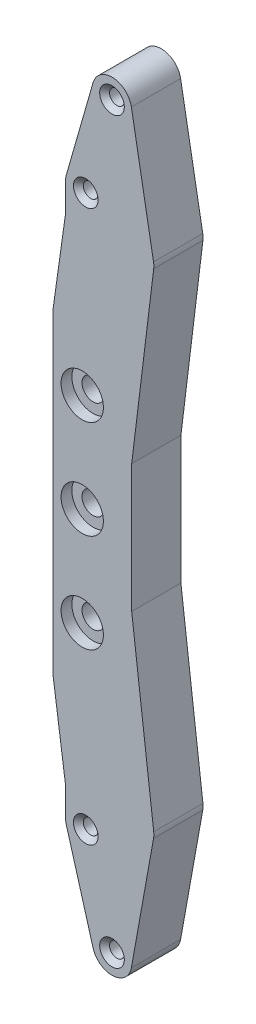
from build123d import *

# Parameters (mm, degrees)
BOSS_EXTRUDE1_DEPTH             = 10
CBORE_FOR_M4_SBHCS1_D           = 4.5
CBORE_FOR_M4_SBHCS1_CBORE_D     = 8.6
CBORE_FOR_M4_SBHCS1_CBORE_DEPTH = 2.2
CSK_FOR_M3_SFHCS1_D             = 3
CSK_FOR_M3_SFHCS1_CSINK_D       = 5
CSK_FOR_M3_SFHCS1_CSINK_ANGLE   = 90


with BuildPart() as part:
    # Sketch1 → Boss-Extrude1 (new body)
    with BuildSketch(Plane.XY):
        with BuildLine():
            Line((20.436693838, 18.708620927), (19.344510591, 24.776314356))
            Line((19.344510591, 24.776314356), (15.93670037, 43.708620578))
            ThreePointArc((15.93670037, 43.708620578), (12.202200675, 46.994894023), (8.154920075, 44.102559177))
            Line((8.154920075, 44.102559177), (2.711450691, 25.118928734))
            ThreePointArc((2.711450691, 25.118928734), (2.59310332, 24.564962257), (2.551837824, 24.000000209))
            Line((2.551837824, 24.000000209), (2.527056728, 18.001748249))
            Line((2.527056728, 18.001748249), (0, 0))
            Line((0, 0), (0, -64.000001177))
            Line((0, -64.000001177), (2.527056728, -82.001749426))
            Line((2.527056728, -82.001749426), (2.551837824, -88.000001386))
            ThreePointArc((2.551837824, -88.000001386), (2.59310332, -88.564963435), (2.711450691, -89.118929911))
            Line((2.711450691, -89.118929911), (8.154920075, -108.102560354))
            ThreePointArc((8.154920075, -108.102560354), (12.202200675, -110.9948952), (15.93670037, -107.708621755))
            Line((15.93670037, -107.708621755), (19.344510591, -88.776315534))
            Line((19.344510591, -88.776315534), (20.436693838, -82.708622104))
            ThreePointArc((20.436693838, -82.708622104), (20.49837734, -82.112535779), (20.470315461, -81.513923807))
            Line((20.470315461, -81.513923807), (15.999950788, -45.00001147))
            Line((15.999950788, -45.00001147), (15.999950788, -18.999989708))
            Line((15.999950788, -18.999989708), (20.470315461, 17.51392263))
            ThreePointArc((20.470315461, 17.51392263), (20.49837734, 18.112534602), (20.436693838, 18.708620927))
        make_face()
    extrude(amount=-BOSS_EXTRUDE1_DEPTH)

    # CBORE for M4 SBHCS1 (through all)
    with Locations(Plane.XY):
        with Locations((5.95, -32.000000589), (5.95, -12.000000589), (5.95, -52.000000589)):
            CounterBoreHole(CBORE_FOR_M4_SBHCS1_D / 2, CBORE_FOR_M4_SBHCS1_CBORE_D / 2, CBORE_FOR_M4_SBHCS1_CBORE_DEPTH)

    # CSK for M3 SFHCS1 (through all)
    with Locations(Plane.XY):
        with Locations((11.999966851, -107.00001074), (6.672994537, -87.982975295), (6.672994537, 23.982974118), (11.999966851, 43.000009563)):
            CounterSinkHole(CSK_FOR_M3_SFHCS1_D / 2, CSK_FOR_M3_SFHCS1_CSINK_D / 2, counter_sink_angle=CSK_FOR_M3_SFHCS1_CSINK_ANGLE)


solid = part.part
